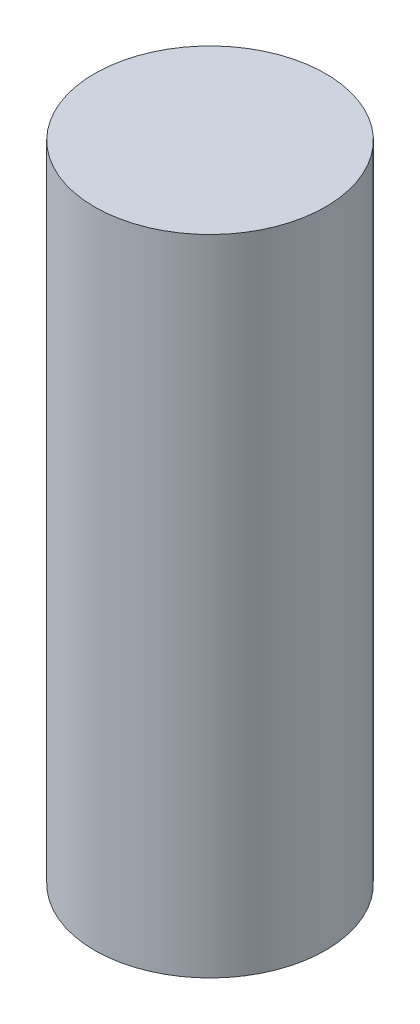
from build123d import *

# Parameters (mm, degrees)
SKETCH1_R           = 31.125
BOSS_EXTRUDE1_DEPTH = 173.5


with BuildPart() as part:
    # Sketch1 → Boss-Extrude1 (new body)
    with BuildSketch(Plane(origin=(0, 0, 0), x_dir=(1, 0, 0), z_dir=(0, 1, 0))):
        Circle(SKETCH1_R)
    extrude(amount=BOSS_EXTRUDE1_DEPTH)


solid = part.part
